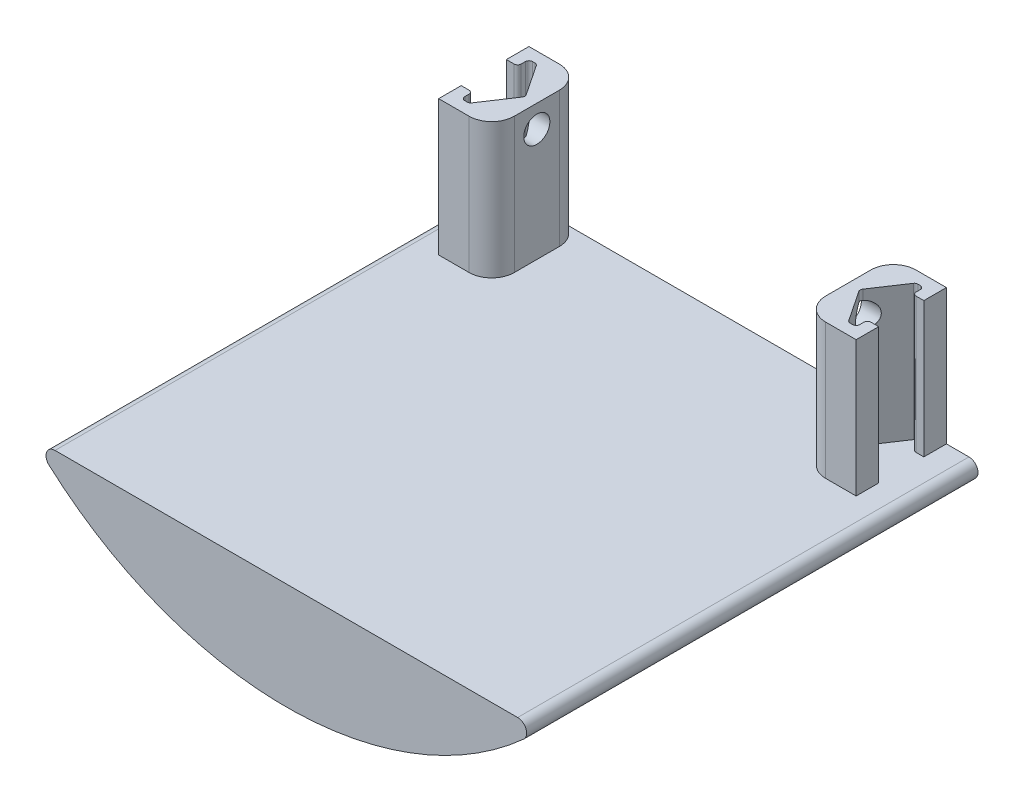
from build123d import *

# Parameters (mm, degrees)
BOSS_EXTRUDE1_DEPTH     = 127
FILLET1_R               = 2.54
BOSS_EXTRUDE2_DEPTH     = 38.1
CUT_EXTRUDE1_DEPTH      = 176.221279464
CUT_EXTRUDE1_DEPTH_BACK = 176.221279464
SKETCH4_R               = 3.675
FILLET2_R               = 1
FILLET3_R               = 6.35


with BuildPart() as part:
    # Sketch1 → Boss-Extrude1 (new body)
    with BuildSketch(Plane.XY):
        with BuildLine():
            Line((-71.414284285, -70), (71.414284285, -70))
            ThreePointArc((71.414284285, -70), (0, -100), (-71.414284285, -70))
        make_face()
    extrude(amount=BOSS_EXTRUDE1_DEPTH)

    # Fillet1
    fillet1_edges = [part.edges().sort_by_distance(p)[0] for p in [
        (-71.414284285, -70, 63.5),
        (71.414284285, -70, 63.5),
    ]]
    fillet(fillet1_edges, radius=FILLET1_R)

    # Sketch2 → Boss-Extrude2 (add)
    with BuildSketch(Plane(origin=(0, -70, 0), x_dir=(1, 0, 0), z_dir=(0, 1, 0))):
        Polygon((-58.737633234, -6.35), (-58.737633234, 0), (-43.815133234, 0), (-43.815133234, -25.4), (-58.737633234, -25.4), (-58.737633234, -19.05), (-55.562633234, -19.05), (-55.562633234, -22.225), (-53.340133234, -22.225), (-46.990133234, -12.7), (-53.340133234, -3.175), (-55.562633234, -3.175), (-55.562633234, -6.35), align=None)
    boss_extrude2 = extrude(amount=BOSS_EXTRUDE2_DEPTH)

    # Mirror1: Boss-Extrude2 across plane
    add(boss_extrude2.mirror(Plane(origin=(0, 0, 0), x_dir=(0, 0, 1), z_dir=(1, 0, 0))))

    # Sketch4 → Cut-Extrude1 (cut, two sides: drawn at the far end of the back side and taken through both)
    with BuildSketch(Plane(origin=(0, 0, 0), x_dir=(0, 0, -1), z_dir=(1, 0, 0)).offset(-CUT_EXTRUDE1_DEPTH_BACK)):
        with Locations((-12.7, -38.25)):
            Circle(SKETCH4_R)
    extrude(amount=CUT_EXTRUDE1_DEPTH + CUT_EXTRUDE1_DEPTH_BACK, mode=Mode.SUBTRACT)

    # Fillet2
    fillet2_edges = [part.edges().sort_by_distance(p)[0] for p in [
        (55.562633234, -50.95, 3.175),
        (53.340133234, -50.95, 3.175),
        (55.562633234, -50.95, 19.05),
        (55.562633234, -50.95, 6.35),
        (46.990133234, -33.2375, 12.7),
        (46.990133234, -55.9625, 12.7),
        (53.340133234, -50.95, 22.225),
        (55.562633234, -50.95, 22.225),
        (-53.340133234, -50.95, 22.225),
        (-55.562633234, -50.95, 19.05),
        (-55.562633234, -50.95, 22.225),
        (-46.990133234, -55.9625, 12.7),
        (-46.990133234, -33.2375, 12.7),
        (-53.340133234, -50.95, 3.175),
        (-55.562633234, -50.95, 3.175),
        (-55.562633234, -50.95, 6.35),
    ]]
    fillet(fillet2_edges, radius=FILLET2_R)

    # Fillet3
    fillet3_edges = [part.edges().sort_by_distance(p)[0] for p in [
        (43.815133234, -50.95, 0),
        (43.815133234, -50.95, 25.4),
        (-43.815133234, -50.95, 0),
        (-43.815133234, -50.95, 25.4),
    ]]
    fillet(fillet3_edges, radius=FILLET3_R)


solid = part.part
